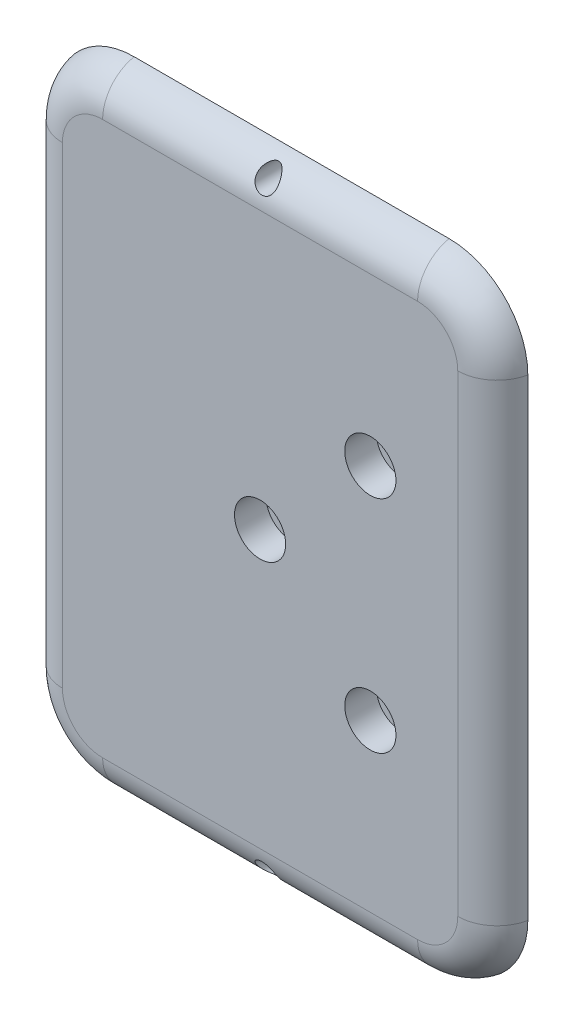
from build123d import *

# Parameters (mm, degrees)
EXTRUDE_1_DEPTH = 3
EXTRUDE_START   = 3
SKETCH_2_R      = 1.35
SKETCH_2_R_2    = 3.25
EXTRUDE_2_DEPTH = 4
FILLET_1_R      = 5


with BuildPart() as part:
    # 草圖1 → 填料-伸長1 (new body)
    with BuildSketch(Plane.XY):
        with BuildLine():
            Line((25.7, -30), (25.7, 30))
            ThreePointArc((25.7, 30), (24.030508653, 34.030508653), (20, 35.7))
            Line((20, 35.7), (-20, 35.7))
            ThreePointArc((-20, 35.7), (-24.030508653, 34.030508653), (-25.7, 30))
            Line((-25.7, 30), (-25.7, -30))
            ThreePointArc((-25.7, -30), (-24.030508653, -34.030508653), (-20, -35.7))
            Line((-20, -35.7), (20, -35.7))
            ThreePointArc((20, -35.7), (24.030508653, -34.030508653), (25.7, -30))
        make_face()
    extrude(amount=EXTRUDE_1_DEPTH)

    # 草圖2 → 填料-伸長2 (add)
    with BuildSketch(Plane.XY.offset(EXTRUDE_START)):
        with BuildLine():
            Line((30, -30), (30, 30))
            ThreePointArc((30, 30), (27.071067812, 37.071067812), (20, 40))
            Line((20, 40), (-20, 40))
            ThreePointArc((-20, 40), (-27.071067812, 37.071067812), (-30, 30))
            Line((-30, 30), (-30, -30))
            ThreePointArc((-30, -30), (-27.071067812, -37.071067812), (-20, -40))
            Line((-20, -40), (20, -40))
            ThreePointArc((20, -40), (27.071067812, -37.071067812), (30, -30))
        make_face()
        with Locations((0, 38)):
            Circle(SKETCH_2_R, mode=Mode.SUBTRACT)
        with Locations((0, -38)):
            Circle(SKETCH_2_R, mode=Mode.SUBTRACT)
        Circle(SKETCH_2_R_2, mode=Mode.SUBTRACT)
        with Locations((14, -14)):
            Circle(SKETCH_2_R_2, mode=Mode.SUBTRACT)
        with Locations((14, 14)):
            Circle(SKETCH_2_R_2, mode=Mode.SUBTRACT)
    extrude(amount=EXTRUDE_2_DEPTH)

    # 圓角1
    # the kernel refuses this fillet: 5 mm, written as the material it takes off along each edge
    with BuildSketch(Plane(origin=(20, -30, 7), x_dir=(0, -1, 0), z_dir=(-1, 0, 0))) as fillet_1_piece_1:
        with BuildLine():
            CenterArc((5.101020514, -5), FILLET_1_R, 11.536959033, 78.463040967)
            Line((5.101020514, 0), (5.101020514, 0.1))
            Line((5.101020514, 0.1), (10, 0.1))
            Line((10, 0.1), (10.1, 0))
            ThreePointArc((10.1, 0), (10.1, -2), (10.09797959, -3.98))
            Line((10.09797959, -3.98), (10, -4))
        make_face()
    revolve(axis=Axis((20, -30, 7), (0, 0, 1)), revolution_arc=90, mode=Mode.SUBTRACT)
    with BuildSketch(Plane(origin=(30, -30, 7), x_dir=(-1.5640821970914211e-12, 0, -1.0), z_dir=(0, 1, 0)), Plane(origin=(-30, 30, 7), x_dir=(1.5640821970914211e-12, 0, -1.0), z_dir=(0, -1, 0))) as fillet_1_piece_2:
        with BuildLine():
            CenterArc((5, 4.898979486), FILLET_1_R, 180, 78.463040967)
            Line((0, 4.898979486), (-0.1, 4.898979486))
            Line((-0.1, 4.898979486), (-0.1, 0))
            Line((-0.1, 0), (0, -0.1))
            ThreePointArc((0, -0.1), (2, -0.1), (3.98, -0.09797959))
            Line((3.98, -0.09797959), (4, 0))
        make_face()
    extrude(amount=60, mode=Mode.SUBTRACT)
    with BuildSketch(Plane(origin=(20, 30, 7), x_dir=(1, 0, 0), z_dir=(0, -1, 0))) as fillet_1_piece_3:
        with BuildLine():
            CenterArc((5.101020514, -5), FILLET_1_R, 11.536959033, 78.463040967)
            Line((5.101020514, 0), (5.101020514, 0.1))
            Line((5.101020514, 0.1), (10, 0.1))
            Line((10, 0.1), (10.1, 0))
            ThreePointArc((10.1, 0), (10.1, -2), (10.09797959, -3.98))
            Line((10.09797959, -3.98), (10, -4))
        make_face()
    revolve(axis=Axis((20, 30, 7), (0, 0, 1)), revolution_arc=90, mode=Mode.SUBTRACT)
    with BuildSketch(Plane(origin=(20, 40, 7), x_dir=(0, -1.5667467323505197e-12, -1.0), z_dir=(-1, 0, 0)), Plane(origin=(-20, -40, 7), x_dir=(0, 1.5667467323505197e-12, -1.0), z_dir=(1, 0, 0))) as fillet_1_piece_4:
        with BuildLine():
            CenterArc((5, 4.898979486), FILLET_1_R, 180, 78.463040967)
            Line((0, 4.898979486), (-0.1, 4.898979486))
            Line((-0.1, 4.898979486), (-0.1, 0))
            Line((-0.1, 0), (0, -0.1))
            ThreePointArc((0, -0.1), (2, -0.1), (3.98, -0.09797959))
            Line((3.98, -0.09797959), (4, 0))
        make_face()
    extrude(amount=40, mode=Mode.SUBTRACT)
    with BuildSketch(Plane(origin=(-20, 30, 7), x_dir=(0, 1, 0), z_dir=(1, 0, 0))) as fillet_1_piece_5:
        with BuildLine():
            CenterArc((5.101020514, -5), FILLET_1_R, 11.536959033, 78.463040967)
            Line((5.101020514, 0), (5.101020514, 0.1))
            Line((5.101020514, 0.1), (10, 0.1))
            Line((10, 0.1), (10.1, 0))
            ThreePointArc((10.1, 0), (10.1, -2), (10.09797959, -3.98))
            Line((10.09797959, -3.98), (10, -4))
        make_face()
    revolve(axis=Axis((-20, 30, 7), (0, 0, 1)), revolution_arc=90, mode=Mode.SUBTRACT)
    with BuildSketch(Plane(origin=(-20, -30, 7), x_dir=(-1, 0, 0), z_dir=(0, 1, 0))) as fillet_1_piece_6:
        with BuildLine():
            CenterArc((5.101020514, -5), FILLET_1_R, 11.536959033, 78.463040967)
            Line((5.101020514, 0), (5.101020514, 0.1))
            Line((5.101020514, 0.1), (10, 0.1))
            Line((10, 0.1), (10.1, 0))
            ThreePointArc((10.1, 0), (10.1, -2), (10.09797959, -3.98))
            Line((10.09797959, -3.98), (10, -4))
        make_face()
    revolve(axis=Axis((-20, -30, 7), (0, 0, 1)), revolution_arc=90, mode=Mode.SUBTRACT)


solid = part.part
